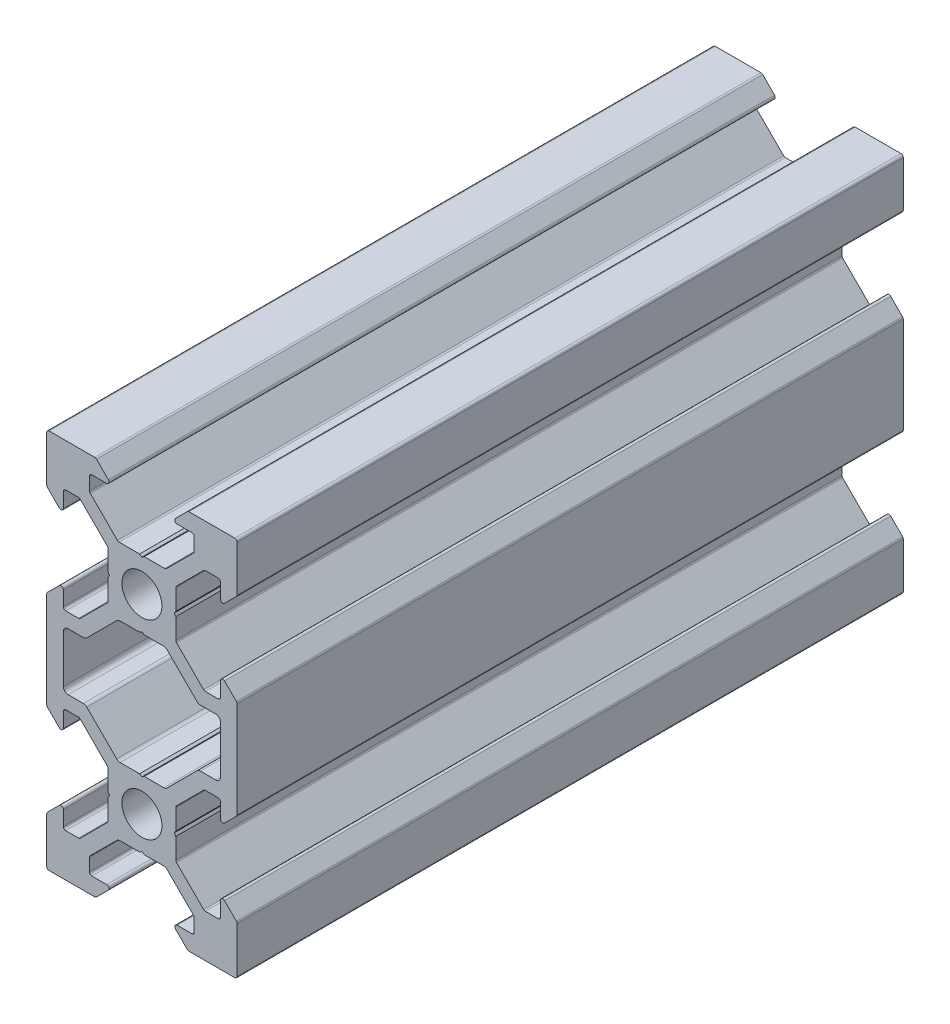
from build123d import *

# Parameters (mm, degrees)
SKETCH1_R           = 2.1
BOSS_EXTRUDE1_DEPTH = 70
FILLET1_R           = 0.25
FILLET2_R           = 0.5
CUT_EXTRUDE1_DEPTH  = 77.811457479


with BuildPart() as part:
    # Sketch1 → Boss-Extrude1 (new body)
    with BuildSketch(Plane.XY):
        Polygon((3.560660172, -2.5), (3.560660172, 2.5), (6.560660172, 5.5), (8.252142372, 5.5), (8.252142372, 3.1), (10, 4.847857628), (10, 10), (4.847857628, 10), (3.1, 8.252142372), (5.5, 8.252142372), (5.5, 6.560660172), (2.5, 3.560660172), (-2.5, 3.560660172), (-5.5, 6.560660172), (-5.5, 8.252142372), (-3.1, 8.252142372), (-4.847857628, 10), (-10, 10), (-10, 4.847857628), (-8.252142372, 3.1), (-8.252142372, 5.5), (-6.560660172, 5.5), (-3.560660172, 2.5), (-3.560660172, -2.5), (-6.560660172, -5.5), (-8.252142372, -5.5), (-8.252142372, -3.1), (-10, -4.847857628), (-10, -7), (-10, -13), (-10, -15.152142372), (-8.252142372, -16.9), (-8.252142372, -14.5), (-6.560660172, -14.5), (-3.560660172, -17.5), (-3.560660172, -22.5), (-6.560660172, -25.5), (-8.252142372, -25.5), (-8.252142372, -23.1), (-10, -24.847857628), (-10, -30), (-4.847857628, -30), (-3.1, -28.252142372), (-5.5, -28.252142372), (-5.5, -26.560660172), (-2.5, -23.560660172), (2.5, -23.560660172), (5.5, -26.560660172), (5.5, -28.252142372), (3.1, -28.252142372), (4.847857628, -30), (10, -30), (10, -24.847857628), (8.252142372, -23.1), (8.252142372, -25.5), (6.560660172, -25.5), (3.560660172, -22.5), (3.560660172, -17.5), (6.560660172, -14.5), (8.252142372, -14.5), (8.252142372, -16.9), (10, -15.152142372), (10, -13), (10, -7), (10, -4.847857628), (8.252142372, -3.1), (8.252142372, -5.5), (6.560660172, -5.5), align=None)
        Circle(SKETCH1_R, mode=Mode.SUBTRACT)
        with Locations((0, -20)):
            Circle(SKETCH1_R, mode=Mode.SUBTRACT)
        Polygon((2.5, -3.560660172), (-2.5, -3.560660172), (-5.5, -6.560660172), (-5.939339828, -7), (-8.252142372, -7), (-8.252142372, -13), (-5.939339828, -13), (-5.5, -13.439339828), (-2.5, -16.439339828), (2.5, -16.439339828), (5.5, -13.439339828), (5.939339828, -13), (8.252142372, -13), (8.252142372, -7), (5.939339828, -7), (5.5, -6.560660172), align=None, mode=Mode.SUBTRACT)
    extrude(amount=BOSS_EXTRUDE1_DEPTH)

    # Fillet1
    fillet1_edges = [part.edges().sort_by_distance(p)[0] for p in [
        (5.5, 6.560660172, 35),
        (5.5, 8.252142372, 35),
        (3.1, 8.252142372, 35),
        (4.847857628, 10, 35),
        (10, 10, 35),
        (10, 4.847857628, 35),
        (8.252142372, 3.1, 35),
        (8.252142372, 5.5, 35),
        (6.560660172, 5.5, 35),
        (3.560660172, 2.5, 35),
        (3.560660172, -2.5, 35),
        (6.560660172, -5.5, 35),
        (8.252142372, -5.5, 35),
        (8.252142372, -3.1, 35),
        (10, -4.847857628, 35),
        (10, -15.152142372, 35),
        (8.252142372, -16.9, 35),
        (8.252142372, -14.5, 35),
        (6.560660172, -14.5, 35),
        (3.560660172, -17.5, 35),
        (3.560660172, -22.5, 35),
        (6.560660172, -25.5, 35),
        (8.252142372, -25.5, 35),
        (8.252142372, -23.1, 35),
        (10, -24.847857628, 35),
        (10, -30, 35),
        (4.847857628, -30, 35),
        (3.1, -28.252142372, 35),
        (5.5, -28.252142372, 35),
        (5.5, -26.560660172, 35),
        (2.5, -23.560660172, 35),
        (-2.5, -23.560660172, 35),
        (-5.5, -26.560660172, 35),
        (-5.5, -28.252142372, 35),
        (-3.1, -28.252142372, 35),
        (-4.847857628, -30, 35),
        (-10, -30, 35),
        (-10, -24.847857628, 35),
        (-8.252142372, -23.1, 35),
        (-8.252142372, -25.5, 35),
        (-6.560660172, -25.5, 35),
        (-3.560660172, -22.5, 35),
        (-3.560660172, -17.5, 35),
        (-6.560660172, -14.5, 35),
        (-8.252142372, -14.5, 35),
        (-8.252142372, -16.9, 35),
        (-10, -15.152142372, 35),
        (-10, -4.847857628, 35),
        (-8.252142372, -3.1, 35),
        (-8.252142372, -5.5, 35),
        (-6.560660172, -5.5, 35),
        (-3.560660172, -2.5, 35),
        (-3.560660172, 2.5, 35),
        (-6.560660172, 5.5, 35),
        (-8.252142372, 5.5, 35),
        (-8.252142372, 3.1, 35),
        (-10, 4.847857628, 35),
        (-10, 10, 35),
        (-4.847857628, 10, 35),
        (-5.5, 8.252142372, 35),
        (-5.5, 6.560660172, 35),
        (-2.5, 3.560660172, 35),
        (2.5, 3.560660172, 35),
        (-3.1, 8.252142372, 35),
    ]]
    fillet(fillet1_edges, radius=FILLET1_R)

    # Fillet2
    fillet2_edges = [part.edges().sort_by_distance(p)[0] for p in [
        (-5.939339828, -7, 35),
        (-8.252142372, -7, 35),
        (-8.252142372, -13, 35),
        (-5.939339828, -13, 35),
        (-2.5, -16.439339828, 35),
        (2.5, -16.439339828, 35),
        (8.252142372, -7, 35),
        (5.939339828, -7, 35),
        (2.5, -3.560660172, 35),
        (-2.5, -3.560660172, 35),
        (5.939339828, -13, 35),
        (8.252142372, -13, 35),
    ]]
    fillet(fillet2_edges, radius=FILLET2_R)

    # Sketch2 → Cut-Extrude1 (cut, through all)
    with BuildSketch(Plane.XY.offset(70)):
        Polygon((0, 3.398953432), (-0.242280927, 3.560660172), (0.242280927, 3.560660172), align=None)
        Polygon((0, -3.398953432), (0.242280927, -3.560660172), (-0.242280927, -3.560660172), align=None)
        Polygon((3.560660172, 0.242280927), (3.560660172, -0.242280927), (3.398953432, 0), align=None)
        Polygon((-3.560660172, 0.242280927), (-3.560660172, -0.242280927), (-3.398953432, 0), align=None)
        Polygon((-3.398953432, -20), (-3.560660172, -20.242280927), (-3.560660172, -19.757719073), align=None)
        Polygon((3.398953432, -20), (3.560660172, -19.757719073), (3.560660172, -20.242280927), align=None)
        Polygon((-0.242280927, -16.439339828), (0.242280927, -16.439339828), (0, -16.601046568), align=None)
        Polygon((-0.242280927, -23.560660172), (0.242280927, -23.560660172), (0, -23.398953432), align=None)
    extrude(amount=-CUT_EXTRUDE1_DEPTH, mode=Mode.SUBTRACT)


solid = part.part
